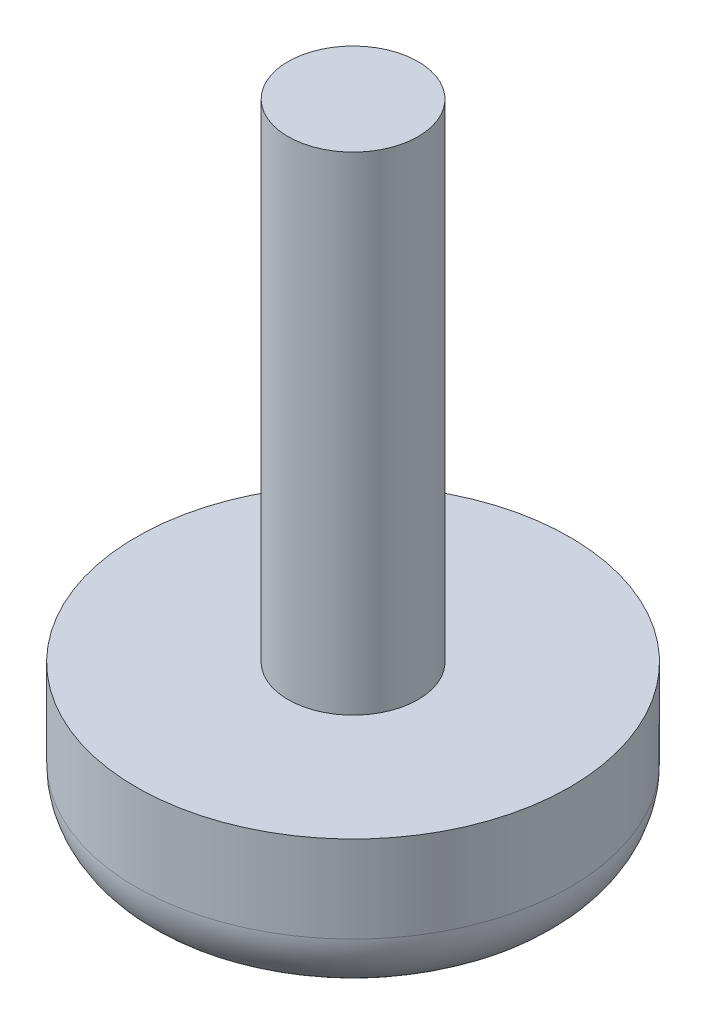
from build123d import *

# Parameters (mm, degrees)
CONG_1_R = 3


with BuildPart() as part:
    # Esquisse1 → Révolution1 (revolve)
    with BuildSketch(Plane.XY):
        Polygon((0, -7), (0, 22.5), (-3, 22.5), (-3, 0), (-10, 0), (-10, -7), align=None)
    revolve(axis=Axis((0, 0, 0), (0, 1, 0)))

    # Congé1
    cong_1_edges = [part.edges().sort_by_distance(p)[0] for p in [
        (10, -7, 0),
    ]]
    fillet(cong_1_edges, radius=CONG_1_R)


solid = part.part
